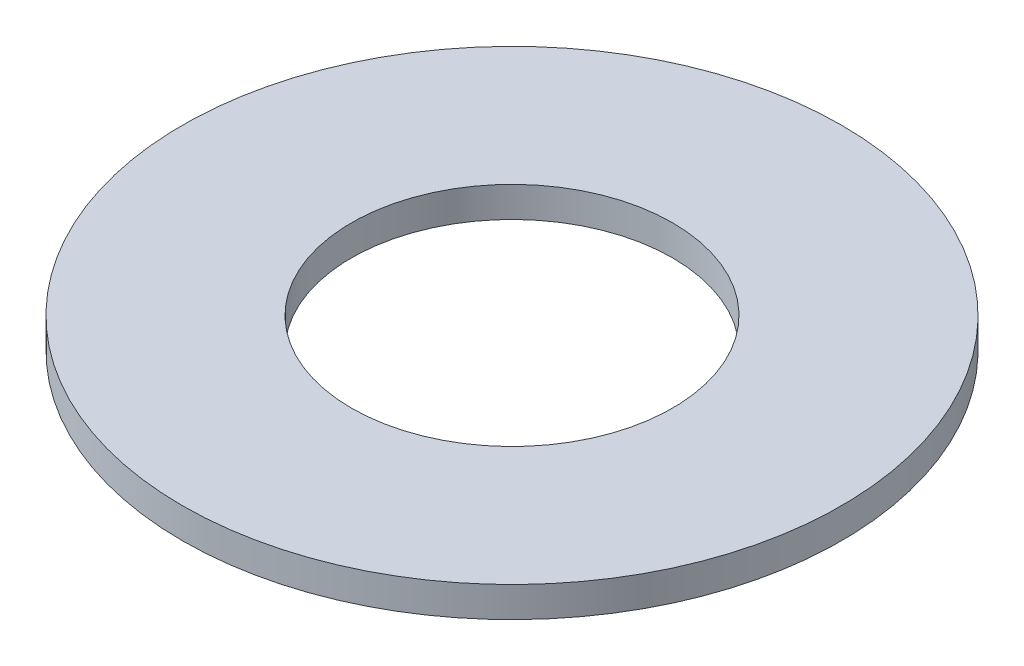
from build123d import *

# Parameters (mm, degrees)
SKETCH1_R           = 97.5
BOSS_EXTRUDE1_DEPTH = 9
SKETCH2_R           = 47.5
CUT_EXTRUDE1_DEPTH  = 139.179231435


with BuildPart() as part:
    # Sketch1 → Boss-Extrude1 (new body)
    with BuildSketch(Plane(origin=(0, 0, 0), x_dir=(1, 0, 0), z_dir=(0, 1, 0))):
        Circle(SKETCH1_R)
    extrude(amount=BOSS_EXTRUDE1_DEPTH)

    # Sketch2 → Cut-Extrude1 (cut, through all)
    with BuildSketch(Plane(origin=(0, 0, 0), x_dir=(1, 0, 0), z_dir=(0, 1, 0))):
        Circle(SKETCH2_R)
    extrude(amount=CUT_EXTRUDE1_DEPTH, mode=Mode.SUBTRACT)


solid = part.part
